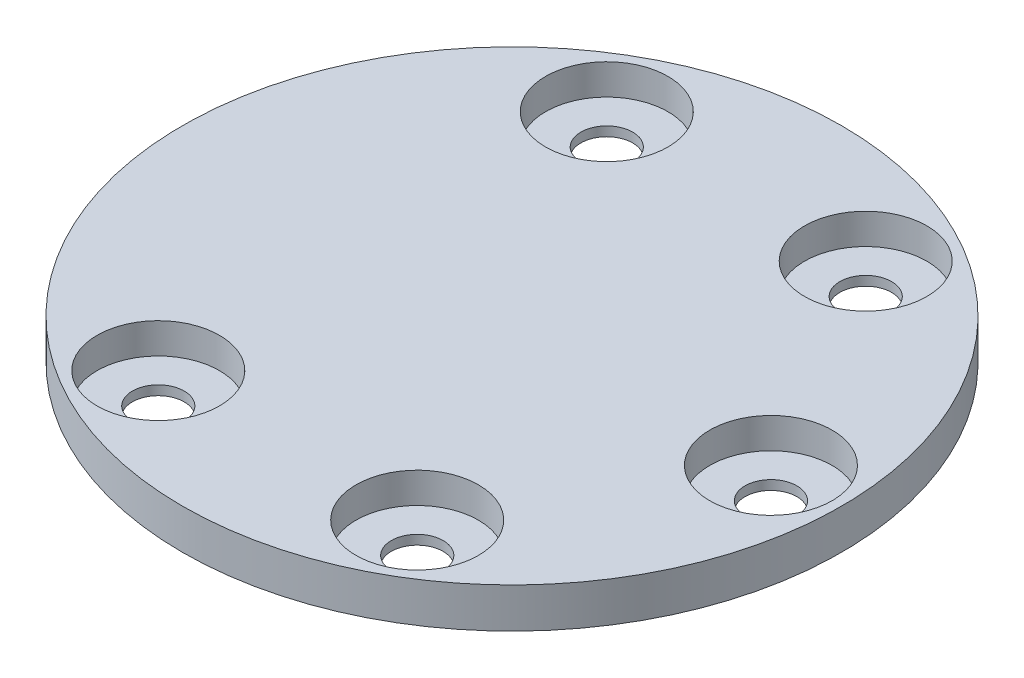
from build123d import *

# Parameters (mm, degrees)
SKETCH1_R           = 14
BOSS_EXTRUDE1_DEPTH = 1.7
CIRPATTERN1_COUNT   = 6
SKETCH8_W           = 1.8
SKETCH8_H           = 0.8
BOSS_EXTRUDE2_DEPTH = 1
FILLET1_R           = 0.25


with BuildPart() as part:
    # Sketch1 → Boss-Extrude1 (new body)
    with BuildSketch(Plane(origin=(0, 0, 0), x_dir=(1, 0, 0), z_dir=(0, 1, 0))):
        Circle(SKETCH1_R)
    extrude(amount=BOSS_EXTRUDE1_DEPTH)

    # Sketch7 → CBORE for M5 Hex Head Bolt1 (revolve, cut)
    with BuildSketch(Plane(origin=(11, 1.7, 0), x_dir=(0, 0, 1), z_dir=(1, 0, 0))):
        Polygon((0, 0), (0, 5.660946681), (1.1, 5), (1.1, 1.3), (2.6, 1.3), (2.6, 0), align=None)
    cbore_for_m5_hex_head_bolt1 = revolve(axis=Axis((11, 8.05, 0), (0, -1, 0)), mode=Mode.SUBTRACT)

    # CirPattern1: CBORE for M5 Hex Head Bolt1 ×6 about axis, 1 skipped
    cirpattern1_axis = Axis((0, 1.7, 0), (0, 1, 0))
    add([cbore_for_m5_hex_head_bolt1.rotate(cirpattern1_axis, i * 360 / CIRPATTERN1_COUNT) for i in range(1, CIRPATTERN1_COUNT) if i not in (3,)], mode=Mode.SUBTRACT)

    # Sketch8 → Boss-Extrude2 (add)
    with BuildSketch(Plane.XZ):
        with Locations((4, 0)):
            Rectangle(SKETCH8_W, SKETCH8_H)
    extrude(amount=BOSS_EXTRUDE2_DEPTH)

    # Fillet1
    fillet1_edges = [part.edges().sort_by_distance(p)[0] for p in [
        (4.9, -0.5, 0.4),
        (3.1, -0.5, 0.4),
        (3.1, -0.5, -0.4),
        (4.9, -0.5, -0.4),
        (4, -1, 0.4),
        (4.9, -1, 0),
        (4, -1, -0.4),
        (3.1, -1, 0),
    ]]
    fillet(fillet1_edges, radius=FILLET1_R)


solid = part.part
